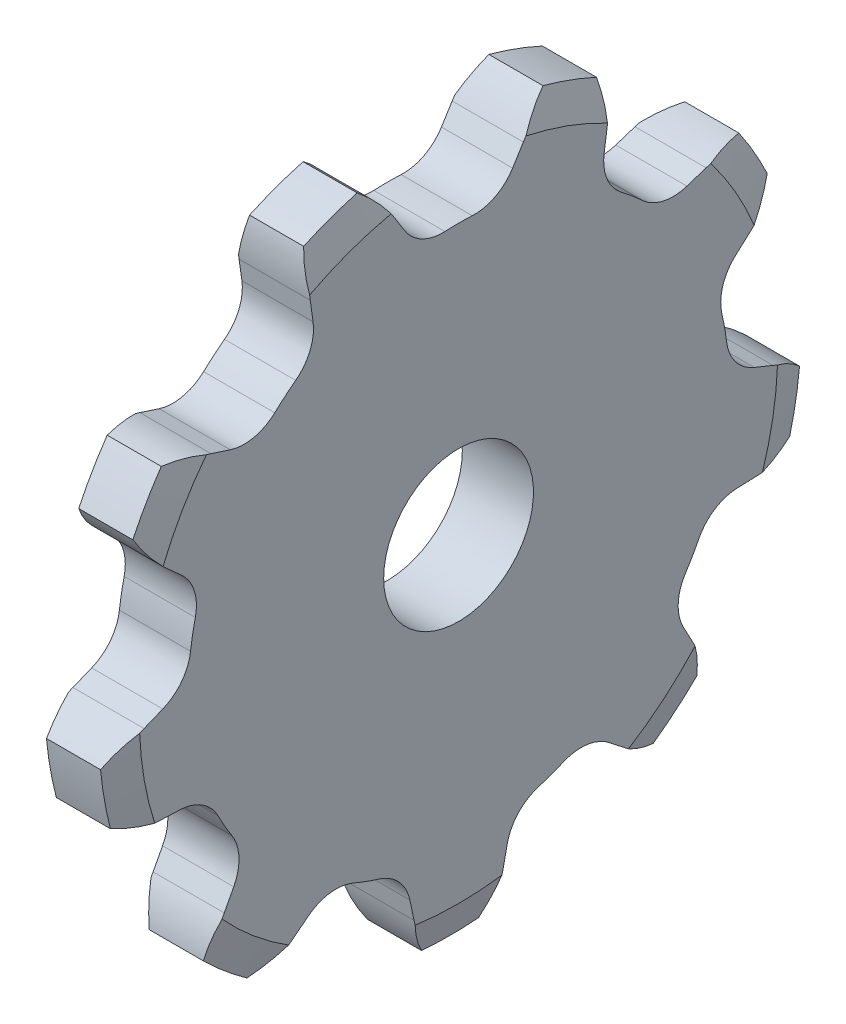
from build123d import *

# Parameters (mm, degrees)
TOOTHCUT_DEPTH  = 171.054362593
TEETHCUTS_COUNT = 9
TEETHCUTS_ANGLE = 320
BORSKE_R        = 25.4
BORE_DEPTH      = 76.2000508


with BuildPart() as part:
    # BasProSke → Base-Revolve (revolve)
    with BuildSketch(Plane(origin=(0, 0, 0), x_dir=(1, 0, 0), z_dir=(0, 1, 0))):
        Polygon((0, 0), (0, 108.223363493), (2.8956, 119.029889811), (21.2344, 119.029889811), (24.13, 108.223363493), (24.13, 0), align=None)
    revolve(axis=Axis((-10, 0, 0), (1, 0, 0)))

    # TooCutSke → ToothCut (cut, through all)
    with BuildSketch(Plane(origin=(0, 0, 0), x_dir=(0, 0, -1), z_dir=(1, 0, 0))):
        with BuildLine():
            Line((-18.325370038, 98.612349363), (-21.959556352, 104.428263206))
            ThreePointArc((-21.959556352, 104.428263206), (-31.443843384, 114.743551158), (-44.015812128, 120.932449921))
            Line((-44.015812128, 120.932449921), (-48.359467948, 132.866546205))
            ThreePointArc((-48.359467948, 132.866546205), (0, 141.393625177), (48.359467948, 132.866546205))
            Line((48.359467948, 132.866546205), (44.015812128, 120.932449921))
            ThreePointArc((44.015812128, 120.932449921), (31.443843384, 114.743551158), (21.959556352, 104.428263206))
            Line((21.959556352, 104.428263206), (18.325370038, 98.612349363))
            ThreePointArc((18.325370038, 98.612349363), (12.450179763, 93.176534652), (4.630575849, 91.467810868))
            ThreePointArc((4.630575849, 91.467810868), (0, 91.584947768), (-4.630575849, 91.467810868))
            ThreePointArc((-4.630575849, 91.467810868), (-12.450179763, 93.176534652), (-18.325370038, 98.612349363))
        make_face()
    toothcut = extrude(amount=TOOTHCUT_DEPTH, mode=Mode.SUBTRACT)

    # TeethCuts: ToothCut ×9 about axis
    teethcuts_axis = Axis((-10, 0, 0), (1, 0, 0))
    for i in range(1, TEETHCUTS_COUNT):
        add(toothcut.rotate(teethcuts_axis, i * TEETHCUTS_ANGLE / (TEETHCUTS_COUNT - 1)), mode=Mode.SUBTRACT)

    # BorSke → Bore (cut, symmetric)
    with BuildSketch(Plane(origin=(0, 0, 0), x_dir=(0, 0, -1), z_dir=(1, 0, 0))):
        Circle(BORSKE_R)
    extrude(amount=BORE_DEPTH, both=True, mode=Mode.SUBTRACT)


solid = part.part
